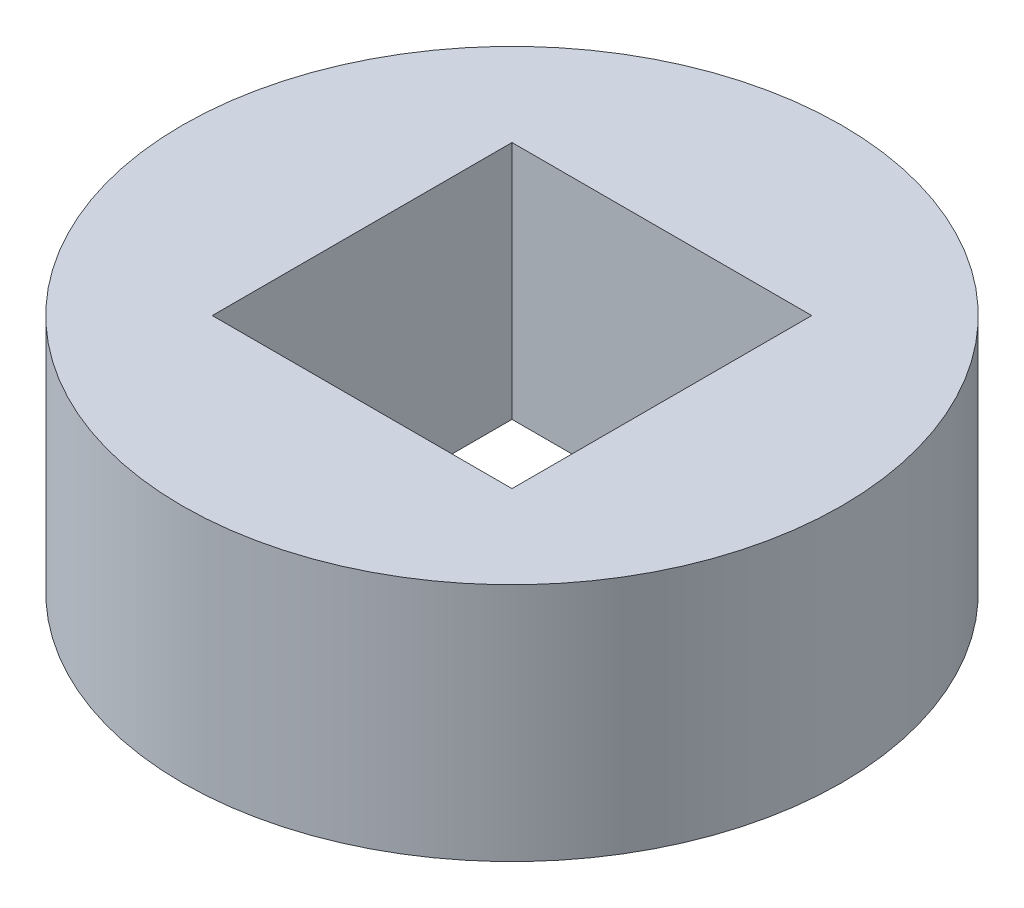
from build123d import *

# Parameters (mm, degrees)
SKETCH1_R           = 27.5
SKETCH1_W           = 25
SKETCH1_H           = 25
BOSS_EXTRUDE1_DEPTH = 20


with BuildPart() as part:
    # Sketch1 → Boss-Extrude1 (new body)
    with BuildSketch(Plane(origin=(0, 0, 0), x_dir=(1, 0, 0), z_dir=(0, 1, 0))):
        Circle(SKETCH1_R)
        Rectangle(SKETCH1_W, SKETCH1_H, mode=Mode.SUBTRACT)
    extrude(amount=BOSS_EXTRUDE1_DEPTH)


solid = part.part
